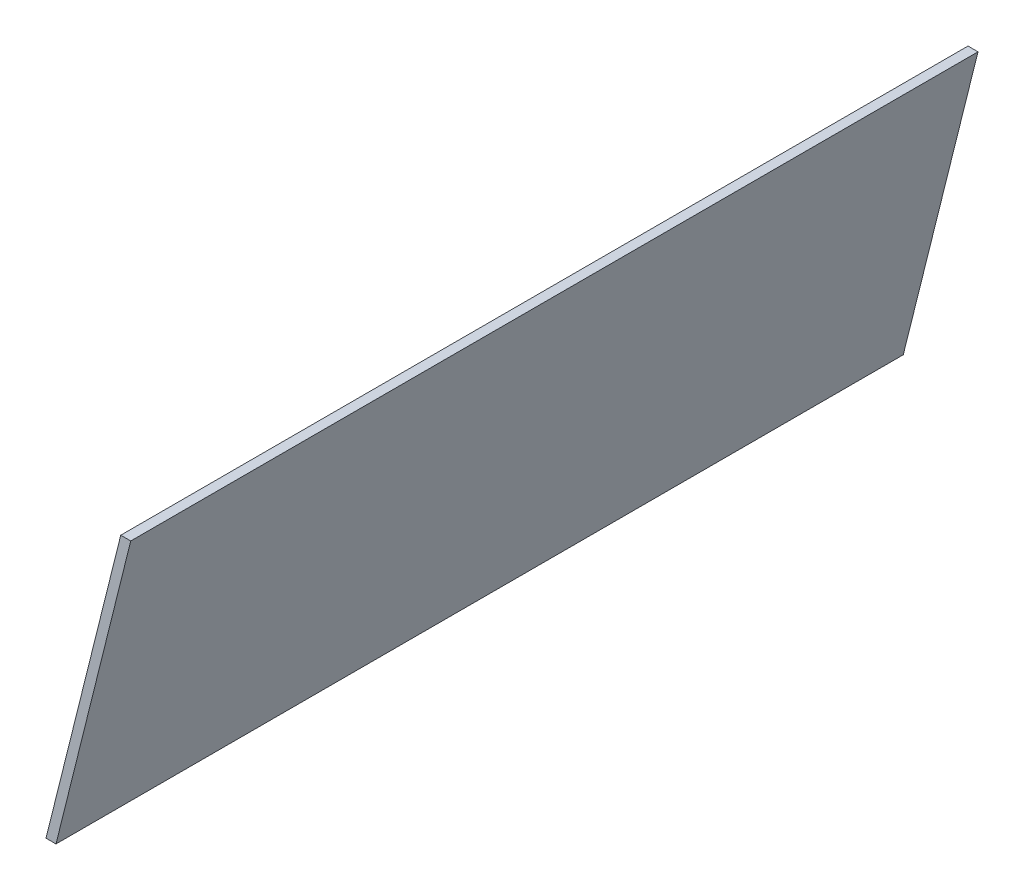
from build123d import *

# Parameters (mm, degrees)
BOSS_EXTRUDE1_DEPTH = 277.475


with BuildPart() as part:
    # Sketch1 → Boss-Extrude1 (new body)
    with BuildSketch(Plane.XY):
        Polygon((-40.901707192, -38.824877845), (-37.629508919, -38.824877845), (-13.15173224, 59.350122155), (-16.423930513, 59.350122155), align=None)
    extrude(amount=BOSS_EXTRUDE1_DEPTH)


solid = part.part
